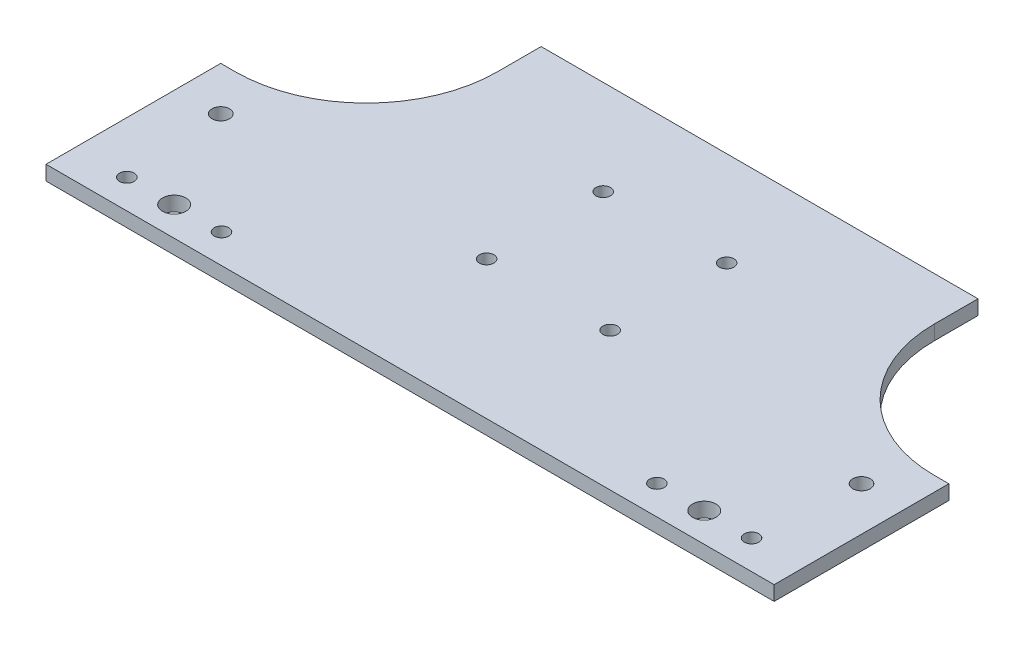
from build123d import *

# Parameters (mm, degrees)
SKETCH1_R           = 4
BOSS_EXTRUDE1_DEPTH = 5
SKETCH2_R           = 3
SKETCH2_R_2         = 2.5
CUT_EXTRUDE1_DEPTH  = 10


with BuildPart() as part:
    # Sketch1 → Boss-Extrude1 (new body)
    with BuildSketch(Plane(origin=(0, 0, 0), x_dir=(1, 0, 0), z_dir=(0, 1, 0))):
        with BuildLine():
            Line((-125, -45), (125, -45))
            Line((125, -45), (125, 15))
            Line((125, 15), (120, 15))
            ThreePointArc((120, 15), (88.180194847, 28.180194847), (75, 60))
            Line((75, 60), (75, 75))
            Line((75, 75), (0, 75))
            Line((0, 75), (-75, 75))
            Line((-75, 75), (-75, 60))
            ThreePointArc((-75, 60), (-88.180194847, 28.180194847), (-120, 15))
            Line((-120, 15), (-125, 15))
            Line((-125, 15), (-125, -45))
        make_face()
        with Locations((-91, -35)):
            Circle(SKETCH1_R, mode=Mode.SUBTRACT)
        with Locations((91, -35)):
            Circle(SKETCH1_R, mode=Mode.SUBTRACT)
    extrude(amount=BOSS_EXTRUDE1_DEPTH)

    # Sketch2 → Cut-Extrude1 (cut)
    with BuildSketch(Plane.XZ):
        with Locations((110, 0)):
            Circle(SKETCH2_R)
        with Locations((74.75, 35)):
            Circle(SKETCH2_R_2)
        with Locations((107.25, 35)):
            Circle(SKETCH2_R_2)
        with Locations((-110, 0)):
            Circle(SKETCH2_R)
        with Locations((-74.75, 35)):
            Circle(SKETCH2_R_2)
        with Locations((-107.25, 35)):
            Circle(SKETCH2_R_2)
        with Locations((-21.2, -2.5)):
            Circle(SKETCH2_R_2)
        with Locations((21.2, -2.5)):
            Circle(SKETCH2_R_2)
        with Locations((-21.2, -42.5)):
            Circle(SKETCH2_R_2)
        with Locations((21.2, -42.5)):
            Circle(SKETCH2_R_2)
    extrude(amount=-CUT_EXTRUDE1_DEPTH, mode=Mode.SUBTRACT)


solid = part.part
